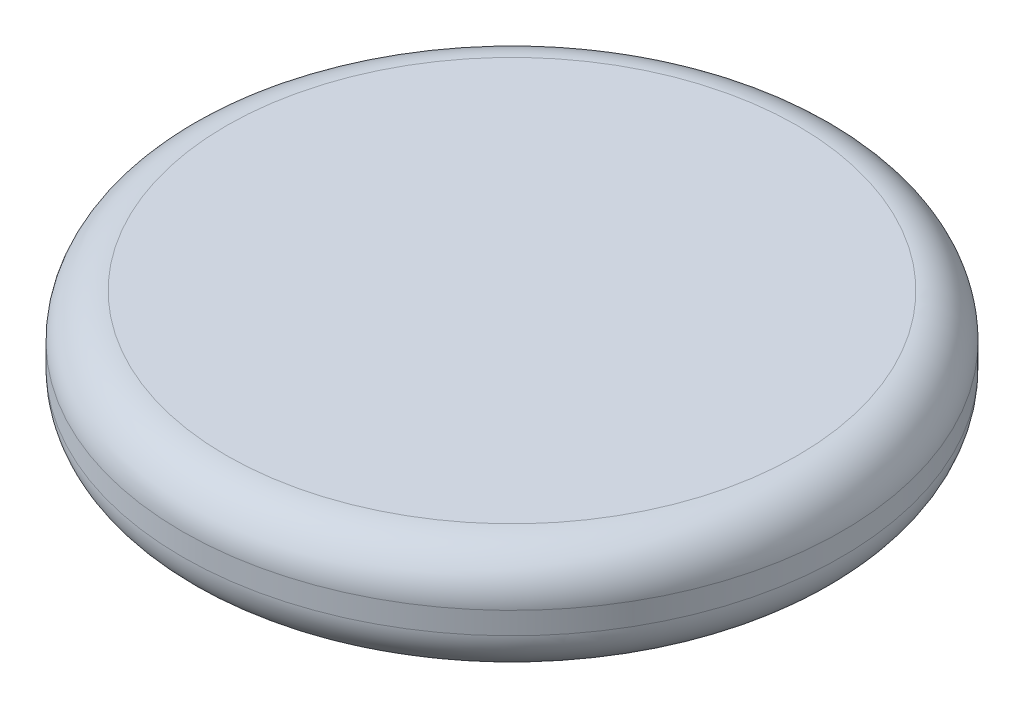
from build123d import *

# Parameters (mm, degrees)
SKETCH2_R           = 75
BOSS_EXTRUDE1_DEPTH = 25
FILLET1_R           = 10
SCALE1_SCALE        = 0.333333333


with BuildPart() as part:
    # Sketch2 → Boss-Extrude1 (new body)
    with BuildSketch(Plane(origin=(0, 0, 0), x_dir=(1, 0, 0), z_dir=(0, 1, 0))):
        Circle(SKETCH2_R)
    extrude(amount=BOSS_EXTRUDE1_DEPTH)

    # Fillet1
    fillet1_edges = [part.edges().sort_by_distance(p)[0] for p in [
        (-75, 0, 0),
        (-75, 25, 0),
    ]]
    fillet(fillet1_edges, radius=FILLET1_R)


with BuildPart() as part_1:
    # Scale1: scaled about (0, 0, 0)
    add(part.part.scale(SCALE1_SCALE))


solid = part_1.part
